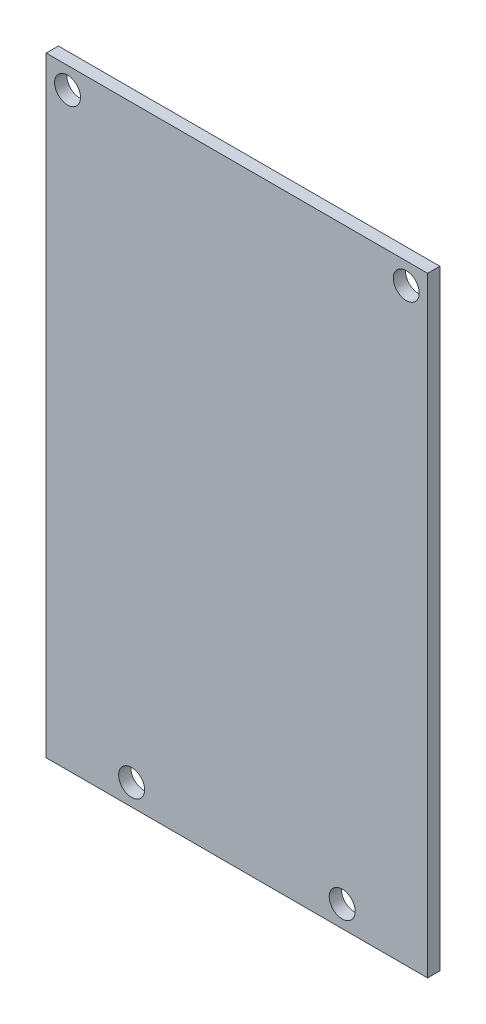
from build123d import *

# Parameters (mm, degrees)
ESQUISSE1_W        = 50
ESQUISSE1_H        = 80
BOSS_EXTRU_1_DEPTH = 1.6
D_GAGEMENT_M31_D   = 3.4


with BuildPart() as part:
    # Esquisse1 → Boss.-Extru.1 (new body)
    with BuildSketch(Plane.XY):
        Rectangle(ESQUISSE1_W, ESQUISSE1_H)
    extrude(amount=BOSS_EXTRU_1_DEPTH)

    # Dégagement M31 (through all)
    with Locations(Plane.XY.offset(1.6)):
        with Locations((-22.2, 37.2), (22.2, 37.2), (13.800000038, -37.2), (-13.800000038, -37.2)):
            Hole(D_GAGEMENT_M31_D / 2)


solid = part.part
